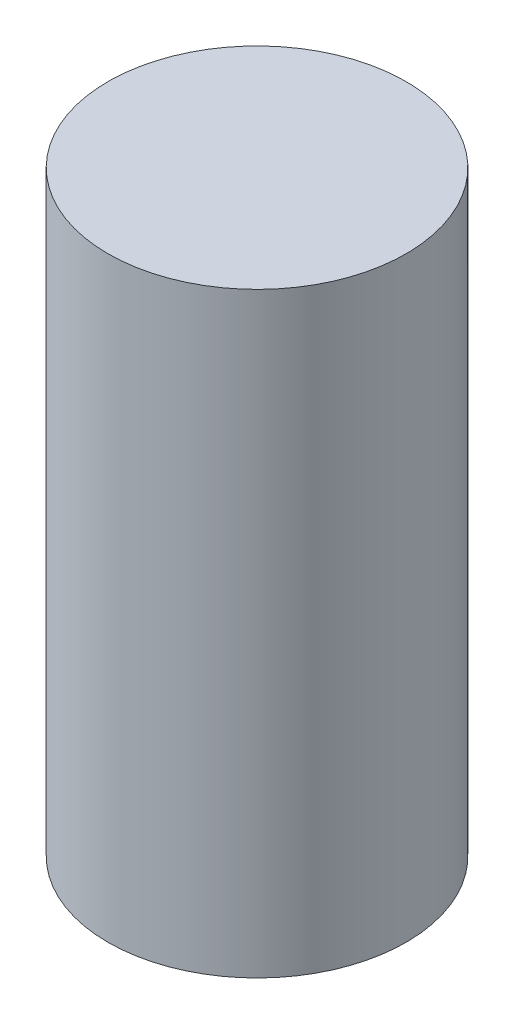
from build123d import *

# Parameters (mm, degrees)
SKETCH2_R           = 1.5875
BOSS_EXTRUDE1_DEPTH = 6.35


with BuildPart() as part:
    # Sketch2 → Boss-Extrude1 (new body)
    with BuildSketch(Plane(origin=(0, 0, 0), x_dir=(1, 0, 0), z_dir=(0, 1, 0))):
        Circle(SKETCH2_R)
    extrude(amount=BOSS_EXTRUDE1_DEPTH)


solid = part.part
